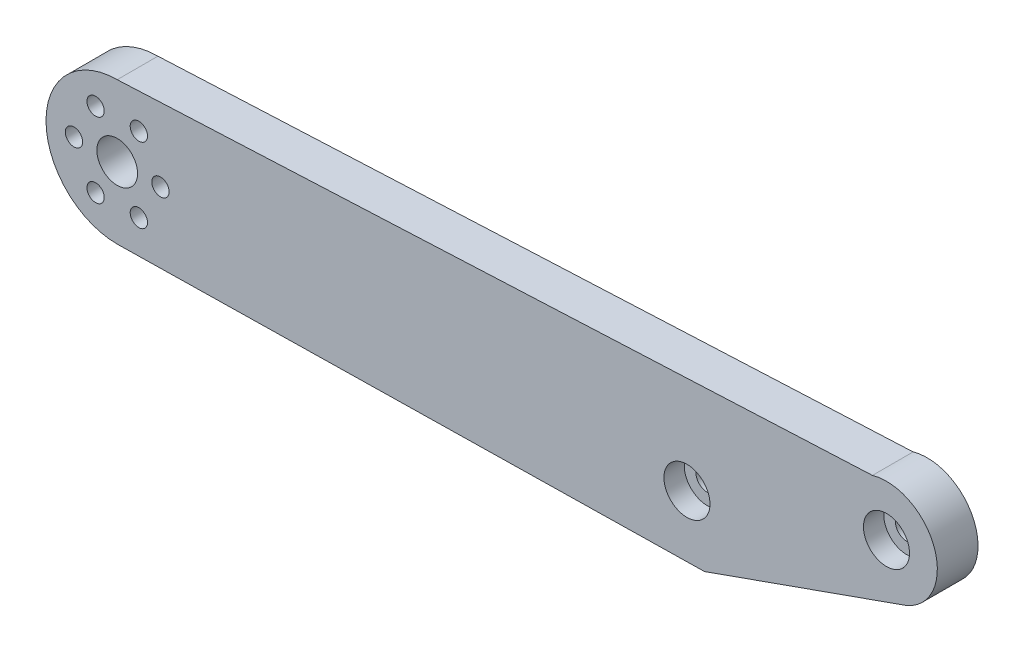
from build123d import *

# Parameters (mm, degrees)
SKETCH1_R           = 4
SKETCH1_R_2         = 1.7
SKETCH1_R_3         = 2.25
BOSS_EXTRUDE1_DEPTH = 8
SKETCH2_R           = 4.525
CUT_EXTRUDE1_DEPTH  = 4


with BuildPart() as part:
    # Sketch1 → Boss-Extrude1 (new body)
    with BuildSketch(Plane.XY):
        with BuildLine():
            Line((-112, -14), (3.447, -12.016))
            Line((3.447, -12.016), (41.977, 1.637))
            ThreePointArc((41.977, 1.637), (48.833, 14.007), (36.463, 20.863))
            Line((36.463, 20.863), (-112, 14))
            ThreePointArc((-112, 14), (-126, 0), (-112, -14))
        make_face()
        with Locations((-112, 0)):
            Circle(SKETCH1_R, mode=Mode.SUBTRACT)
        with Locations((-103.5, 0)):
            Circle(SKETCH1_R_2, mode=Mode.SUBTRACT)
        with Locations((-107.75, 7.361)):
            Circle(SKETCH1_R_2, mode=Mode.SUBTRACT)
        with Locations((-116.25, 7.361)):
            Circle(SKETCH1_R_2, mode=Mode.SUBTRACT)
        with Locations((-120.5, 0)):
            Circle(SKETCH1_R_2, mode=Mode.SUBTRACT)
        with Locations((-116.25, -7.361)):
            Circle(SKETCH1_R_2, mode=Mode.SUBTRACT)
        with Locations((-107.75, -7.361)):
            Circle(SKETCH1_R_2, mode=Mode.SUBTRACT)
        Circle(SKETCH1_R_3, mode=Mode.SUBTRACT)
        with Locations((39.22, 11.25)):
            Circle(SKETCH1_R_3, mode=Mode.SUBTRACT)
    extrude(amount=BOSS_EXTRUDE1_DEPTH)

    # Sketch2 → Cut-Extrude1 (cut)
    with BuildSketch(Plane.XY.offset(8)):
        Circle(SKETCH2_R)
        with Locations((39.22, 11.25)):
            Circle(SKETCH2_R)
    extrude(amount=-CUT_EXTRUDE1_DEPTH, mode=Mode.SUBTRACT)


solid = part.part
